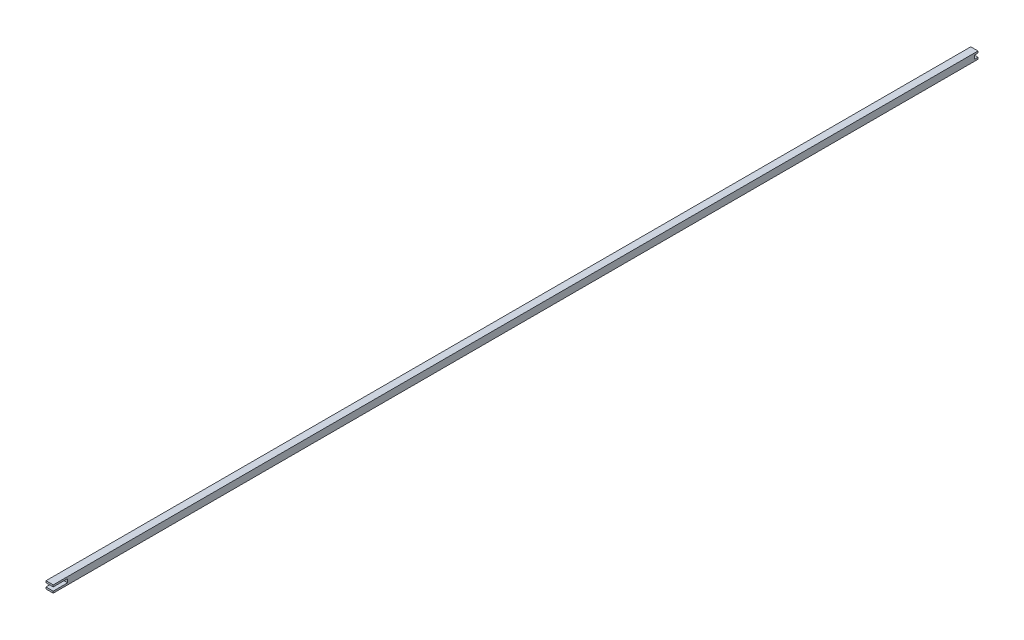
from build123d import *

# Parameters (mm, degrees)
BOSS_EXTRUDE1_DEPTH = 3.175


with BuildPart() as part:
    # Sketch1 → Boss-Extrude1 (new, symmetric)
    with BuildSketch(Plane.YZ):
        Polygon((3.175, 406.4), (3.175, -406.4), (1.5875, -406.4), (1.5875, -403.225), (-1.5875, -403.225), (-1.5875, -406.4), (-3.175, -406.4), (-3.175, 406.4), (-1.5875, 406.4), (-1.5875, 393.7), (1.5875, 393.7), (1.5875, 406.4), align=None)
    extrude(amount=BOSS_EXTRUDE1_DEPTH, both=True)


solid = part.part
